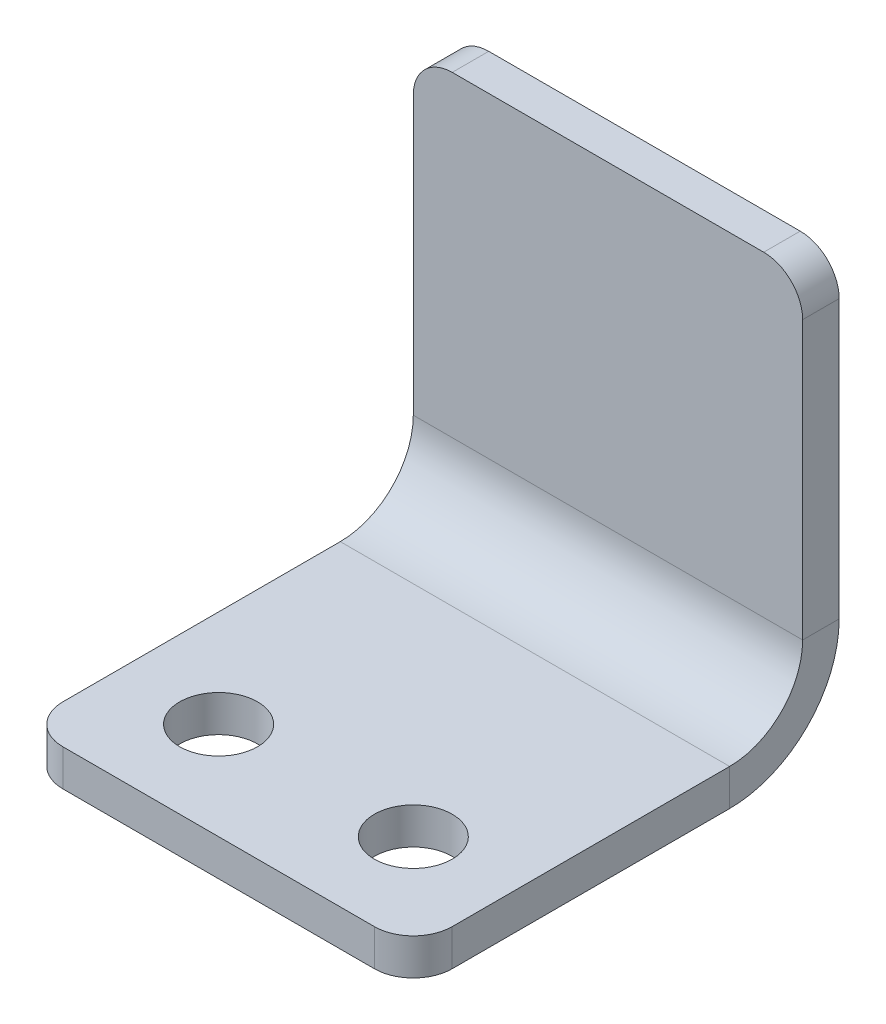
from build123d import *

# Parameters (mm, degrees)
SKETCH1_W              = 25.4
SKETCH1_H              = 27.78125
BOSS_EXTRUDE1_DEPTH    = 2.38125
SKETCH2_W              = 25.4
SKETCH2_H              = 2.38125
BOSS_EXTRUDE2_DEPTH    = 25.4
CONVERT_SOLID2_START   = -12.7
CONVERT_SOLID2_DEPTH   = 25.4
CONVERT_SOLID2_2_DEPTH = 25.4
FILLET1_R              = 2.54
SKETCH9_R              = 2.54
CUT_EXTRUDE1_DEPTH     = 2.38125


# Read off the part's stored shape, not the designer's step: Convert-Solid2
with BuildPart() as part:
    # Sketch1 → Boss-Extrude1 (new body)
    with BuildSketch(Plane(origin=(0, 0, 0), x_dir=(1, 0, 0), z_dir=(0, 1, 0))):
        Rectangle(SKETCH1_W, SKETCH1_H)
    extrude(amount=BOSS_EXTRUDE1_DEPTH)

    # Sketch2 → Boss-Extrude2 (add)
    with BuildSketch(Plane(origin=(0, 2.38125, 0), x_dir=(1, 0, 0), z_dir=(0, 1, 0))):
        with Locations((0, 12.7)):
            Rectangle(SKETCH2_W, SKETCH2_H)
    extrude(amount=BOSS_EXTRUDE2_DEPTH)

    # Convert-Solid2 outline → Convert-Solid2 (cut)
    with BuildSketch(Plane.YZ.offset(CONVERT_SOLID2_START)):
        with BuildLine():
            Line((0, -13.890625), (7.14375, -13.890625))
            ThreePointArc((7.14375, -13.890625), (2.092355932, -11.798269068), (0, -6.746875))
            Line((0, -6.746875), (0, -13.890625))
        make_face()
    extrude(amount=CONVERT_SOLID2_DEPTH, mode=Mode.SUBTRACT)

    # Convert-Solid2 2 outline → Convert-Solid2 2 (add)
    with BuildSketch(Plane.YZ.offset(CONVERT_SOLID2_START)):
        with BuildLine():
            Line((2.38125, -11.509375), (7.14375, -11.509375))
            ThreePointArc((7.14375, -11.509375), (3.776153955, -10.114471045), (2.38125, -6.746875))
            Line((2.38125, -6.746875), (2.38125, -11.509375))
        make_face()
    extrude(amount=CONVERT_SOLID2_2_DEPTH)

    # Fillet1
    fillet1_edges = [part.edges().sort_by_distance(p)[0] for p in [
        (-12.7, 1.190625, 13.890625),
        (12.7, 1.190625, 13.890625),
        (-12.7, 27.78125, -12.7),
        (12.7, 27.78125, -12.7),
    ]]
    fillet(fillet1_edges, radius=FILLET1_R)

    # Sketch9 → Cut-Extrude1 (cut)
    with BuildSketch(Plane(origin=(0, 2.38125, 0), x_dir=(1, 0, 0), z_dir=(0, 1, 0))):
        with Locations(Location((6.35, -7.540625, 0), (0, 0, 270))):
            Circle(SKETCH9_R)
        with Locations(Location((-6.35, -7.540625, 0), (0, 0, 270))):
            Circle(SKETCH9_R)
    extrude(amount=-CUT_EXTRUDE1_DEPTH, mode=Mode.SUBTRACT)


solid = part.part
